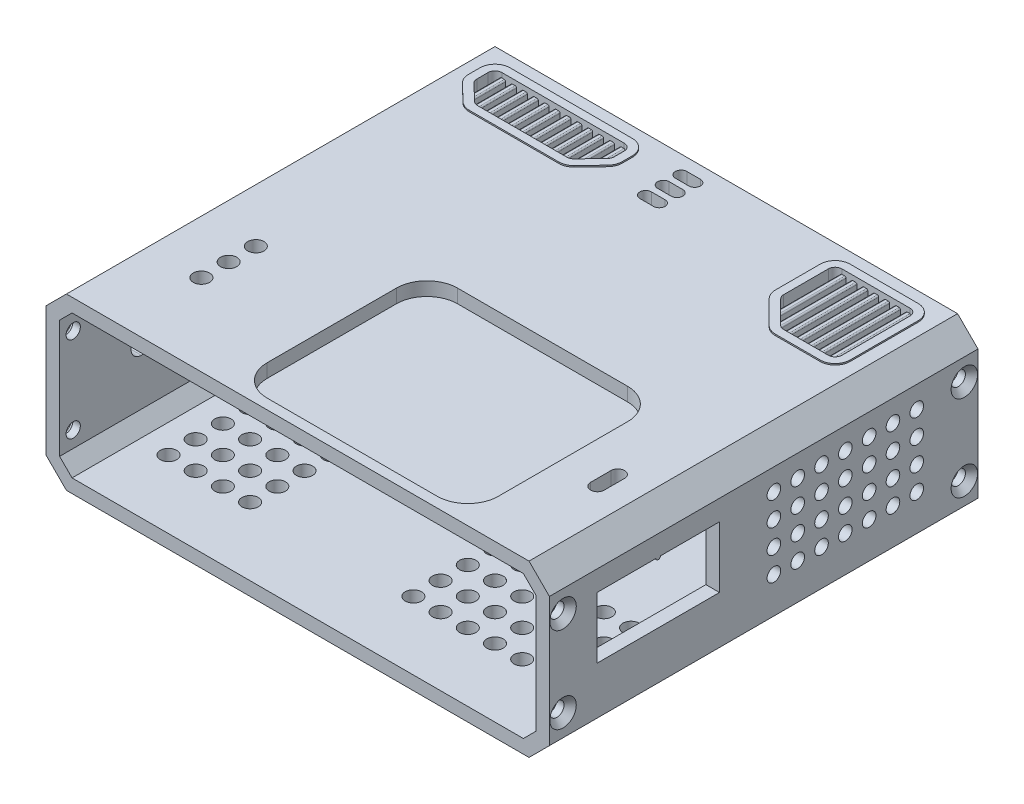
from build123d import *

# Parameters (mm, degrees)
SKETCH_1_W           = 74
SKETCH_1_H           = 63
EXTRUDE_1_DEPTH      = 25
CHAMFER_1_SIZE       = 3
CUT_EXTRUDE_1_DEPTH  = 78.238017391
CUT_EXTRUDE_2_REACH  = 67.167
CUT_EXTRUDE_3_REACH  = 67.167
SKETCH_5_R           = 1.2
SKETCH_6_R           = 1.05
CUT_EXTRUDE_4_DEPTH  = 92.384239478
CHAMFER_2_SIZE       = 0.9
CUT_EXTRUDE_5_REACH  = 67.167
CUT_EXTRUDE_6_REACH  = 93.384
CUT_EXTRUDE_7_REACH  = 93.384
SKETCH_9_W           = 4
SKETCH_9_H           = 2
FILLET_1_R           = 1
SKETCH_10_R          = 1
CUT_EXTRUDE_8_DEPTH  = 2
CUT_EXTRUDE_9_REACH  = 93.384
SKETCH_11_W          = 18
SKETCH_11_H          = 9
SKETCH_12_W          = 2
SKETCH_12_H          = 7.3
EXTRUDE_2_DEPTH      = 20
CHAMFER_3_SIZE       = 6
SKETCH_13_W          = 66.34314575
SKETCH_13_H          = 7.3
CUT_EXTRUDE_10_DEPTH = 10
SKETCH_15_R          = 1
CUT_EXTRUDE_12_DEPTH = 2
SKETCH_16_W          = 2
SKETCH_16_H          = 3
EXTRUDE_3_DEPTH      = 4
SKETCH_18_R          = 1.2
CUT_EXTRUDE_13_DEPTH = 65.426629242
SKETCH_19_R          = 0.325
EXTRUDE_4_DEPTH      = 2
EXTRUDE_5_DEPTH      = 0.2
CUT_EXTRUDE_START    = -2
CUT_EXTRUDE_15_DEPTH = 2
SKETCH_23_W          = 0.8
SKETCH_23_H          = 13.273646536
SKETCH_23_H_2        = 8.723645734
EXTRUDE_6_DEPTH      = 1.5
FILLET_2_R           = 0.2
CUT_EXTRUDE_16_REACH = 67.167


with BuildPart() as part:
    # 草图1 → 凸台-拉伸1 (new body)
    with BuildSketch(Plane(origin=(0, 0, 0), x_dir=(1, 0, 0), z_dir=(0, 1, 0))):
        with Locations((0.036621478, 15.935)):
            Rectangle(SKETCH_1_W, SKETCH_1_H)
    extrude(amount=EXTRUDE_1_DEPTH)

    # 倒角1
    chamfer_1_edges = [part.edges().sort_by_distance(p)[0] for p in [
        (37.036621478, 25, -15.935),
        (-36.963378522, 25, -15.935),
        (37.036621478, 0, -15.935),
        (-36.963378522, 0, -15.935),
    ]]
    chamfer(chamfer_1_edges, length=CHAMFER_1_SIZE)

    # 草图2 → 切除-拉伸1 (cut, through all)
    with BuildSketch(Plane.XY.offset(15.565)):
        Polygon((-33.134951397, 2), (33.208194353, 2), (35.036621478, 3.828427125), (35.036621478, 21.171572875), (33.208194353, 23), (-33.134951397, 23), (-34.963378522, 21.171572875), (-34.963378522, 3.828427125), align=None)
    extrude(amount=-CUT_EXTRUDE_1_DEPTH, mode=Mode.SUBTRACT)

    # 草图4 → 切除-拉伸2 (cut, up to next)
    with BuildSketch(Plane(origin=(0, 25, 0), x_dir=(1, 0, 0), z_dir=(0, 1, 0)), mode=Mode.PRIVATE) as cut_extrude_2_sk1:
        with BuildLine():
            Line((-5.963378522, 13.935), (19.036621478, 13.935))
            ThreePointArc((19.036621478, 13.935), (22.218601993, 12.616980515), (23.536621478, 9.435))
            Line((23.536621478, 9.435), (23.536621478, -9.565))
            ThreePointArc((23.536621478, -9.565), (22.218601993, -12.746980515), (19.036621478, -14.065))
            Line((19.036621478, -14.065), (-5.963378522, -14.065))
            ThreePointArc((-5.963378522, -14.065), (-9.145359037, -12.746980515), (-10.463378522, -9.565))
            Line((-10.463378522, -9.565), (-10.463378522, 9.435))
            ThreePointArc((-10.463378522, 9.435), (-9.145359037, 12.616980515), (-5.963378522, 13.935))
        make_face()
    cut_extrude_2_tool1 = extrude(cut_extrude_2_sk1.sketch, amount=-CUT_EXTRUDE_2_REACH, mode=Mode.PRIVATE) & part.part
    add(cut_extrude_2_tool1.solids().sort_by_distance((6.536621, 25, 0.065))[0], mode=Mode.SUBTRACT)

    # 草图5 → 切除-拉伸3 (cut, up to next)
    with BuildSketch(Plane(origin=(0, 25, 0), x_dir=(1, 0, 0), z_dir=(0, 1, 0)), mode=Mode.PRIVATE) as cut_extrude_3_sk1:
        with Locations(Location((-26.117438699, 0.435, 0), (0, 0, 270))):
            Circle(SKETCH_5_R)
    cut_extrude_3_tool1 = extrude(cut_extrude_3_sk1.sketch, amount=-CUT_EXTRUDE_3_REACH, mode=Mode.PRIVATE) & part.part
    # 草图5 → 切除-拉伸3 (cut, up to next)
    with BuildSketch(Plane(origin=(0, 25, 0), x_dir=(1, 0, 0), z_dir=(0, 1, 0)), mode=Mode.PRIVATE) as cut_extrude_3_sk2:
        with Locations(Location((-26.117438699, 4.435, 0), (0, 0, 270))):
            Circle(SKETCH_5_R)
    cut_extrude_3_tool2 = extrude(cut_extrude_3_sk2.sketch, amount=-CUT_EXTRUDE_3_REACH, mode=Mode.PRIVATE) & part.part
    # 草图5 → 切除-拉伸3 (cut, up to next)
    with BuildSketch(Plane(origin=(0, 25, 0), x_dir=(1, 0, 0), z_dir=(0, 1, 0)), mode=Mode.PRIVATE) as cut_extrude_3_sk3:
        with Locations(Location((-26.117438699, -3.565, 0), (0, 0, 270))):
            Circle(SKETCH_5_R)
    cut_extrude_3_tool3 = extrude(cut_extrude_3_sk3.sketch, amount=-CUT_EXTRUDE_3_REACH, mode=Mode.PRIVATE) & part.part
    add(cut_extrude_3_tool1.solids().sort_by_distance((-26.117439, 25, -0.435))[0], mode=Mode.SUBTRACT)
    add(cut_extrude_3_tool2.solids().sort_by_distance((-26.117439, 25, -4.435))[0], mode=Mode.SUBTRACT)
    add(cut_extrude_3_tool3.solids().sort_by_distance((-26.117439, 25, 3.565))[0], mode=Mode.SUBTRACT)

    # 草图6 → 切除-拉伸4 (cut, through all)
    with BuildSketch(Plane(origin=(37.036621478, 0, 0), x_dir=(0, 0, -1), z_dir=(1, 0, 0))):
        with Locations((-13.565, 18.8)):
            Circle(SKETCH_6_R)
        with Locations((-13.565, 6.2)):
            Circle(SKETCH_6_R)
        with Locations((45.435, 6.2)):
            Circle(SKETCH_6_R)
        with Locations((45.435, 18.8)):
            Circle(SKETCH_6_R)
    extrude(amount=-CUT_EXTRUDE_4_DEPTH, mode=Mode.SUBTRACT)

    # 倒角2
    chamfer_2_edges = [part.edges().sort_by_distance(p)[0] for p in [
        (-36.963378522, 18.8, -44.385),
        (37.036621478, 18.8, -44.385),
        (-36.963378522, 6.2, -44.385),
        (37.036621478, 6.2, -44.385),
        (-36.963378522, 6.2, 14.615),
        (37.036621478, 6.2, 14.615),
        (-36.963378522, 18.8, 14.615),
        (37.036621478, 18.8, 14.615),
    ]]
    chamfer(chamfer_2_edges, length=CHAMFER_2_SIZE)

    # 草图7 → 切除-拉伸5 (cut, up to next)
    with BuildSketch(Plane(origin=(0, 25, 0), x_dir=(1, 0, 0), z_dir=(0, 1, 0)), mode=Mode.PRIVATE) as cut_extrude_5_sk1:
        with BuildLine():
            Line((30.536621478, 1.9890604), (30.536621478, -1.0109396))
            ThreePointArc((30.536621478, -1.0109396), (29.536621478, -2.0109396), (28.536621478, -1.0109396))
            Line((28.536621478, -1.0109396), (28.536621478, 1.9890604))
            ThreePointArc((28.536621478, 1.9890604), (29.536621478, 2.9890604), (30.536621478, 1.9890604))
        make_face()
    cut_extrude_5_tool1 = extrude(cut_extrude_5_sk1.sketch, amount=-CUT_EXTRUDE_5_REACH, mode=Mode.PRIVATE) & part.part
    add(cut_extrude_5_tool1.solids().sort_by_distance((29.536621, 25, -0.48906))[0], mode=Mode.SUBTRACT)

    # 草图8 → 切除-拉伸6 (cut, up to next)
    with BuildSketch(Plane.ZY.offset(36.963378522), mode=Mode.PRIVATE) as cut_extrude_6_sk1:
        with BuildLine():
            Line((-8.435, 13.7), (3.565, 13.7))
            ThreePointArc((3.565, 13.7), (5.065, 12.2), (3.565, 10.7))
            Line((3.565, 10.7), (-8.435, 10.7))
            ThreePointArc((-8.435, 10.7), (-9.935, 12.2), (-8.435, 13.7))
        make_face()
    cut_extrude_6_tool1 = extrude(cut_extrude_6_sk1.sketch, amount=-CUT_EXTRUDE_6_REACH, mode=Mode.PRIVATE) & part.part
    add(cut_extrude_6_tool1.solids().sort_by_distance((-36.963379, 12.2, -2.435))[0], mode=Mode.SUBTRACT)

    # 草图9 → 切除-拉伸7 (cut, up to next)
    with BuildSketch(Plane.ZY.offset(36.963378522), mode=Mode.PRIVATE) as cut_extrude_7_sk1:
        with Locations((-5.435, 6)):
            Rectangle(SKETCH_9_W, SKETCH_9_H)
    cut_extrude_7_tool1 = extrude(cut_extrude_7_sk1.sketch, amount=-CUT_EXTRUDE_7_REACH, mode=Mode.PRIVATE) & part.part
    add(cut_extrude_7_tool1.solids().sort_by_distance((-36.963379, 6, -5.435))[0], mode=Mode.SUBTRACT)

    # 圆角1
    fillet_1_edges = [part.edges().sort_by_distance(p)[0] for p in [
        (-35.963378522, 5, -3.435),
        (-35.963378522, 7, -3.435),
        (-35.963378522, 7, -7.435),
        (-35.963378522, 5, -7.435),
    ]]
    fillet(fillet_1_edges, radius=FILLET_1_R - 0.0001)  # a hair under: the kernel refuses the full size

    # 草图10 → 切除-拉伸8 (cut)
    with BuildSketch(Plane.ZY.offset(36.963378522)):
        with Locations((6.465, 19)):
            Circle(SKETCH_10_R)
        with Locations((3.265, 19)):
            Circle(SKETCH_10_R)
        with Locations((0.065, 19)):
            Circle(SKETCH_10_R)
        with Locations((-3.135, 19)):
            Circle(SKETCH_10_R)
        with Locations((-6.335, 19)):
            Circle(SKETCH_10_R)
        with Locations((3.265, 15.8)):
            Circle(SKETCH_10_R)
        with Locations((0.065, 15.8)):
            Circle(SKETCH_10_R)
        with Locations((-3.135, 15.8)):
            Circle(SKETCH_10_R)
        with Locations((-6.335, 15.8)):
            Circle(SKETCH_10_R)
        with Locations((6.465, 15.8)):
            Circle(SKETCH_10_R)
        with Locations((-9.535, 19)):
            Circle(SKETCH_10_R)
        with Locations((-12.735, 19)):
            Circle(SKETCH_10_R)
        with Locations((-15.935, 19)):
            Circle(SKETCH_10_R)
        with Locations((-19.135, 19)):
            Circle(SKETCH_10_R)
        with Locations((-22.335, 19)):
            Circle(SKETCH_10_R)
        with Locations((-25.535, 19)):
            Circle(SKETCH_10_R)
        with Locations((-28.735, 19)):
            Circle(SKETCH_10_R)
        with Locations((-31.935, 19)):
            Circle(SKETCH_10_R)
        with Locations((-35.135, 19)):
            Circle(SKETCH_10_R)
        with Locations((-38.335, 19)):
            Circle(SKETCH_10_R)
        with Locations((-9.535, 15.8)):
            Circle(SKETCH_10_R)
        with Locations((-12.735, 15.8)):
            Circle(SKETCH_10_R)
        with Locations((-15.935, 15.8)):
            Circle(SKETCH_10_R)
        with Locations((-19.135, 15.8)):
            Circle(SKETCH_10_R)
        with Locations((-22.335, 15.8)):
            Circle(SKETCH_10_R)
        with Locations((-25.535, 15.8)):
            Circle(SKETCH_10_R)
        with Locations((-28.735, 15.8)):
            Circle(SKETCH_10_R)
        with Locations((-31.935, 15.8)):
            Circle(SKETCH_10_R)
        with Locations((-35.135, 15.8)):
            Circle(SKETCH_10_R)
        with Locations((-38.335, 15.8)):
            Circle(SKETCH_10_R)
    extrude(amount=-CUT_EXTRUDE_8_DEPTH, mode=Mode.SUBTRACT)

    # 草图11 → 切除-拉伸9 (cut, up to next)
    with BuildSketch(Plane(origin=(37.036621478, 0, 0), x_dir=(0, 0, -1), z_dir=(1, 0, 0)), mode=Mode.PRIVATE) as cut_extrude_9_sk1:
        with Locations((0.435, 14.5)):
            Rectangle(SKETCH_11_W, SKETCH_11_H)
    cut_extrude_9_tool1 = extrude(cut_extrude_9_sk1.sketch, amount=-CUT_EXTRUDE_9_REACH, mode=Mode.PRIVATE) & part.part
    add(cut_extrude_9_tool1.solids().sort_by_distance((37.036621, 14.5, -0.435))[0], mode=Mode.SUBTRACT)

    # 草图12 → 凸台-拉伸2 (add)
    with BuildSketch(Plane(origin=(0, 0, -47.435), x_dir=(-1, 0, 0), z_dir=(0, 0, -1))):
        with Locations((25.963378522, 19.35)):
            Rectangle(SKETCH_12_W, SKETCH_12_H)
        with Locations((-16.036621478, 19.35)):
            Rectangle(SKETCH_12_W, SKETCH_12_H)
    extrude(amount=-EXTRUDE_2_DEPTH)

    # 倒角3
    chamfer_3_edges = [part.edges().sort_by_distance(p)[0] for p in [
        (-25.963378522, 15.7, -27.435),
        (16.036621478, 15.7, -27.435),
    ]]
    chamfer(chamfer_3_edges, length=CHAMFER_3_SIZE)

    # 草图13 → 切除-拉伸10 (cut)
    with BuildSketch(Plane(origin=(0, 0, -47.435), x_dir=(-1, 0, 0), z_dir=(0, 0, -1))):
        with Locations((-0.036621478, 19.35)):
            Rectangle(SKETCH_13_W, SKETCH_13_H)
    extrude(amount=-CUT_EXTRUDE_10_DEPTH, mode=Mode.SUBTRACT)

    # 草图15 → 切除-拉伸12 (cut)
    with BuildSketch(Plane(origin=(37.036621478, 0, 0), x_dir=(0, 0, -1), z_dir=(1, 0, 0))):
        with Locations((38.435, 18.8)):
            Circle(SKETCH_15_R)
        with Locations((34.935, 18.8)):
            Circle(SKETCH_15_R)
        with Locations((31.435, 18.8)):
            Circle(SKETCH_15_R)
        with Locations((27.935, 18.8)):
            Circle(SKETCH_15_R)
        with Locations((24.435, 18.8)):
            Circle(SKETCH_15_R)
        with Locations((20.935, 18.8)):
            Circle(SKETCH_15_R)
        with Locations((17.435, 18.8)):
            Circle(SKETCH_15_R)
        with Locations((34.935, 15.3)):
            Circle(SKETCH_15_R)
        with Locations((31.435, 15.3)):
            Circle(SKETCH_15_R)
        with Locations((27.935, 15.3)):
            Circle(SKETCH_15_R)
        with Locations((24.435, 15.3)):
            Circle(SKETCH_15_R)
        with Locations((20.935, 15.3)):
            Circle(SKETCH_15_R)
        with Locations((17.435, 15.3)):
            Circle(SKETCH_15_R)
        with Locations((34.935, 11.8)):
            Circle(SKETCH_15_R)
        with Locations((31.435, 11.8)):
            Circle(SKETCH_15_R)
        with Locations((27.935, 11.8)):
            Circle(SKETCH_15_R)
        with Locations((24.435, 11.8)):
            Circle(SKETCH_15_R)
        with Locations((20.935, 11.8)):
            Circle(SKETCH_15_R)
        with Locations((17.435, 11.8)):
            Circle(SKETCH_15_R)
        with Locations((34.935, 8.3)):
            Circle(SKETCH_15_R)
        with Locations((31.435, 8.3)):
            Circle(SKETCH_15_R)
        with Locations((27.935, 8.3)):
            Circle(SKETCH_15_R)
        with Locations((24.435, 8.3)):
            Circle(SKETCH_15_R)
        with Locations((20.935, 8.3)):
            Circle(SKETCH_15_R)
        with Locations((17.435, 8.3)):
            Circle(SKETCH_15_R)
        with Locations((38.435, 15.3)):
            Circle(SKETCH_15_R)
        with Locations((38.435, 11.8)):
            Circle(SKETCH_15_R)
        with Locations((38.435, 8.3)):
            Circle(SKETCH_15_R)
    extrude(amount=-CUT_EXTRUDE_12_DEPTH, mode=Mode.SUBTRACT)

    # 草图16 → 凸台-拉伸3 (add)
    with BuildSketch(Plane.XZ.offset(-23)):
        with Locations((-27.599018842, -17.035)):
            Rectangle(SKETCH_16_W, SKETCH_16_H)
        with Locations((27.668194353, -17.035)):
            Rectangle(SKETCH_16_W, SKETCH_16_H)
    extrude(amount=EXTRUDE_3_DEPTH)

    # 草图18 → 切除-拉伸13 (cut, through all)
    with BuildSketch(Plane(origin=(0, 2, 0), x_dir=(1, 0, 0), z_dir=(0, 1, 0))):
        with Locations(Location((27.036621478, 6.435, 0), (0, 0, 270))):
            Circle(SKETCH_18_R)
        with Locations(Location((23.036621478, 6.435, 0), (0, 0, 270))):
            Circle(SKETCH_18_R)
        with Locations(Location((19.036621478, 6.435, 0), (0, 0, 270))):
            Circle(SKETCH_18_R)
        with Locations(Location((15.036621478, 6.435, 0), (0, 0, 270))):
            Circle(SKETCH_18_R)
        with Locations(Location((11.036621478, 6.435, 0), (0, 0, 270))):
            Circle(SKETCH_18_R)
        with Locations(Location((7.036621478, 6.435, 0), (0, 0, 270))):
            Circle(SKETCH_18_R)
        with Locations(Location((23.036621478, 2.435, 0), (0, 0, 270))):
            Circle(SKETCH_18_R)
        with Locations(Location((19.036621478, 2.435, 0), (0, 0, 270))):
            Circle(SKETCH_18_R)
        with Locations(Location((15.036621478, 2.435, 0), (0, 0, 270))):
            Circle(SKETCH_18_R)
        with Locations(Location((11.036621478, 2.435, 0), (0, 0, 270))):
            Circle(SKETCH_18_R)
        with Locations(Location((7.036621478, 2.435, 0), (0, 0, 270))):
            Circle(SKETCH_18_R)
        with Locations(Location((23.036621478, -1.565, 0), (0, 0, 270))):
            Circle(SKETCH_18_R)
        with Locations(Location((19.036621478, -1.565, 0), (0, 0, 270))):
            Circle(SKETCH_18_R)
        with Locations(Location((15.036621478, -1.565, 0), (0, 0, 270))):
            Circle(SKETCH_18_R)
        with Locations(Location((11.036621478, -1.565, 0), (0, 0, 270))):
            Circle(SKETCH_18_R)
        with Locations(Location((7.036621478, -1.565, 0), (0, 0, 270))):
            Circle(SKETCH_18_R)
        with Locations(Location((23.036621478, -5.565, 0), (0, 0, 270))):
            Circle(SKETCH_18_R)
        with Locations(Location((19.036621478, -5.565, 0), (0, 0, 270))):
            Circle(SKETCH_18_R)
        with Locations(Location((15.036621478, -5.565, 0), (0, 0, 270))):
            Circle(SKETCH_18_R)
        with Locations(Location((11.036621478, -5.565, 0), (0, 0, 270))):
            Circle(SKETCH_18_R)
        with Locations(Location((7.036621478, -5.565, 0), (0, 0, 270))):
            Circle(SKETCH_18_R)
        with Locations(Location((27.036621478, 2.435, 0), (0, 0, 270))):
            Circle(SKETCH_18_R)
        with Locations(Location((27.036621478, -1.565, 0), (0, 0, 270))):
            Circle(SKETCH_18_R)
        with Locations(Location((27.036621478, -5.565, 0), (0, 0, 270))):
            Circle(SKETCH_18_R)
        with Locations(Location((-16.963378522, 6.435, 0), (0, 0, 270))):
            Circle(SKETCH_18_R)
        with Locations(Location((-20.963378522, 6.435, 0), (0, 0, 270))):
            Circle(SKETCH_18_R)
        with Locations(Location((-24.963378522, 6.435, 0), (0, 0, 270))):
            Circle(SKETCH_18_R)
        with Locations(Location((-20.963378522, 2.435, 0), (0, 0, 270))):
            Circle(SKETCH_18_R)
        with Locations(Location((-24.963378522, 2.435, 0), (0, 0, 270))):
            Circle(SKETCH_18_R)
        with Locations(Location((-20.963378522, -1.565, 0), (0, 0, 270))):
            Circle(SKETCH_18_R)
        with Locations(Location((-24.963378522, -1.565, 0), (0, 0, 270))):
            Circle(SKETCH_18_R)
        with Locations(Location((-20.963378522, -5.565, 0), (0, 0, 270))):
            Circle(SKETCH_18_R)
        with Locations(Location((-24.963378522, -5.565, 0), (0, 0, 270))):
            Circle(SKETCH_18_R)
        with Locations(Location((-16.963378522, 2.435, 0), (0, 0, 270))):
            Circle(SKETCH_18_R)
        with Locations(Location((-16.963378522, -1.565, 0), (0, 0, 270))):
            Circle(SKETCH_18_R)
        with Locations(Location((-16.963378522, -5.565, 0), (0, 0, 270))):
            Circle(SKETCH_18_R)
        with Locations(Location((-28.963378522, 6.435, 0), (0, 0, 270))):
            Circle(SKETCH_18_R)
        with Locations(Location((-28.963378522, 2.435, 0), (0, 0, 270))):
            Circle(SKETCH_18_R)
        with Locations(Location((-28.963378522, -1.565, 0), (0, 0, 270))):
            Circle(SKETCH_18_R)
        with Locations(Location((-28.963378522, -5.565, 0), (0, 0, 270))):
            Circle(SKETCH_18_R)
    extrude(amount=-CUT_EXTRUDE_13_DEPTH, mode=Mode.SUBTRACT)

    # 草图19 → 凸台-拉伸4 (add)
    with BuildSketch(Plane(origin=(37.036621478, 0, 0), x_dir=(0, 0, -1), z_dir=(1, 0, 0))):
        with Locations((0.435, 19)):
            Circle(SKETCH_19_R)
    extrude(amount=-EXTRUDE_4_DEPTH)

    # 草图21 → 凸台-拉伸5 (add)
    # profile 1 of 2: a face of its own
    with BuildSketch(Plane(origin=(0, 25, 0), x_dir=(1, 0, 0), z_dir=(0, 1, 0))):
        with BuildLine():
            Line((-11.963378522, 45.635), (-29.963378522, 45.635))
            ThreePointArc((-29.963378522, 45.635), (-31.519013441, 44.990634919), (-32.163378522, 43.435))
            Line((-32.163378522, 43.435), (-32.163378522, 41.755780742))
            ThreePointArc((-32.163378522, 41.755780742), (-31.9875052, 40.893857782), (-31.488004713, 40.169743234))
            Line((-31.488004713, 40.169743234), (-29.073743874, 37.848962491))
            ThreePointArc((-29.073743874, 37.848962491), (-28.370919813, 37.394254729), (-27.549117683, 37.235))
            Line((-27.549117683, 37.235), (-14.377639361, 37.235))
            ThreePointArc((-14.377639361, 37.235), (-13.5157164, 37.410873322), (-12.791601853, 37.910373809))
            Line((-12.791601853, 37.910373809), (-10.377341014, 40.421880085))
            ThreePointArc((-10.377341014, 40.421880085), (-9.922633251, 41.124704146), (-9.763378522, 41.946506276))
            Line((-9.763378522, 41.946506276), (-9.763378522, 43.435))
            ThreePointArc((-9.763378522, 43.435), (-10.407743603, 44.990634919), (-11.963378522, 45.635))
        make_face()
        with BuildLine():
            Line((-11.963378522, 44.435), (-29.963378522, 44.435))
            ThreePointArc((-29.963378522, 44.435), (-30.670485303, 44.142106781), (-30.963378522, 43.435))
            Line((-30.963378522, 43.435), (-30.963378522, 41.755780742))
            ThreePointArc((-30.963378522, 41.755780742), (-30.883436103, 41.363997578), (-30.656390427, 41.034854602))
            Line((-30.656390427, 41.034854602), (-28.242129588, 38.71407386))
            ThreePointArc((-28.242129588, 38.71407386), (-27.922664106, 38.507388513), (-27.549117683, 38.435))
            Line((-27.549117683, 38.435), (-14.377639361, 38.435))
            ThreePointArc((-14.377639361, 38.435), (-13.985856197, 38.514942419), (-13.656713221, 38.741988095))
            Line((-13.656713221, 38.741988095), (-11.242452382, 41.253494371))
            ThreePointArc((-11.242452382, 41.253494371), (-11.035767035, 41.572959853), (-10.963378522, 41.946506276))
            Line((-10.963378522, 41.946506276), (-10.963378522, 43.435))
            ThreePointArc((-10.963378522, 43.435), (-11.256271741, 44.142106781), (-11.963378522, 44.435))
        make_face(mode=Mode.SUBTRACT)
    # profile 2 of 2: a face of its own
    with BuildSketch(Plane(origin=(0, 25, 0), x_dir=(1, 0, 0), z_dir=(0, 1, 0))):
        with BuildLine():
            Line((32.236621478, 43.435), (32.236621478, 33.435))
            ThreePointArc((32.236621478, 33.435), (31.592256397, 31.879365081), (30.036621478, 31.235))
            Line((30.036621478, 31.235), (23.45083504, 31.235))
            ThreePointArc((23.45083504, 31.235), (22.608931489, 31.402465028), (21.895200122, 31.879365081))
            Line((21.895200122, 31.879365081), (18.480986559, 35.293578644))
            ThreePointArc((18.480986559, 35.293578644), (18.004086506, 36.007310011), (17.836621478, 36.849213562))
            Line((17.836621478, 36.849213562), (17.836621478, 43.435))
            ThreePointArc((17.836621478, 43.435), (18.480986559, 44.990634919), (20.036621478, 45.635))
            Line((20.036621478, 45.635), (30.036621478, 45.635))
            ThreePointArc((30.036621478, 45.635), (31.592256397, 44.990634919), (32.236621478, 43.435))
        make_face()
        with BuildLine():
            Line((31.036621478, 43.435), (31.036621478, 33.435))
            ThreePointArc((31.036621478, 33.435), (30.743728259, 32.727893219), (30.036621478, 32.435))
            Line((30.036621478, 32.435), (23.45083504, 32.435))
            ThreePointArc((23.45083504, 32.435), (23.068151608, 32.511120467), (22.743728259, 32.727893219))
            Line((22.743728259, 32.727893219), (19.329514697, 36.142106781))
            ThreePointArc((19.329514697, 36.142106781), (19.112741945, 36.46653013), (19.036621478, 36.849213562))
            Line((19.036621478, 36.849213562), (19.036621478, 43.435))
            ThreePointArc((19.036621478, 43.435), (19.329514697, 44.142106781), (20.036621478, 44.435))
            Line((20.036621478, 44.435), (30.036621478, 44.435))
            ThreePointArc((30.036621478, 44.435), (30.743728259, 44.142106781), (31.036621478, 43.435))
        make_face(mode=Mode.SUBTRACT)
    extrude(amount=EXTRUDE_5_DEPTH)

    # 草图22 → 切除-拉伸15 (cut)
    with BuildSketch(Plane(origin=(0, 25, 0), x_dir=(1, 0, 0), z_dir=(0, 1, 0)).offset(CUT_EXTRUDE_START)):
        with BuildLine():
            Line((-13.656713221, 38.741988095), (-11.242452382, 41.253494371))
            ThreePointArc((-11.242452382, 41.253494371), (-11.035767035, 41.572959853), (-10.963378522, 41.946506276))
            Line((-10.963378522, 41.946506276), (-10.963378522, 43.435))
            ThreePointArc((-10.963378522, 43.435), (-11.256271741, 44.142106781), (-11.963378522, 44.435))
            Line((-11.963378522, 44.435), (-29.963378522, 44.435))
            ThreePointArc((-29.963378522, 44.435), (-30.670485303, 44.142106781), (-30.963378522, 43.435))
            Line((-30.963378522, 43.435), (-30.963378522, 41.755780742))
            ThreePointArc((-30.963378522, 41.755780742), (-30.883436103, 41.363997578), (-30.656390427, 41.034854602))
            Line((-30.656390427, 41.034854602), (-28.242129588, 38.71407386))
            ThreePointArc((-28.242129588, 38.71407386), (-27.922664106, 38.507388513), (-27.549117683, 38.435))
            Line((-27.549117683, 38.435), (-14.377639361, 38.435))
            ThreePointArc((-14.377639361, 38.435), (-13.985856197, 38.514942419), (-13.656713221, 38.741988095))
        make_face()
        with BuildLine():
            Line((30.036621478, 44.435), (20.036621478, 44.435))
            ThreePointArc((20.036621478, 44.435), (19.329514697, 44.142106781), (19.036621478, 43.435))
            Line((19.036621478, 43.435), (19.036621478, 36.849213562))
            ThreePointArc((19.036621478, 36.849213562), (19.112741945, 36.46653013), (19.329514697, 36.142106781))
            Line((19.329514697, 36.142106781), (22.743728259, 32.727893219))
            ThreePointArc((22.743728259, 32.727893219), (23.068151608, 32.511120467), (23.45083504, 32.435))
            Line((23.45083504, 32.435), (30.036621478, 32.435))
            ThreePointArc((30.036621478, 32.435), (30.743728259, 32.727893219), (31.036621478, 33.435))
            Line((31.036621478, 33.435), (31.036621478, 43.435))
            ThreePointArc((31.036621478, 43.435), (30.743728259, 44.142106781), (30.036621478, 44.435))
        make_face()
    extrude(amount=CUT_EXTRUDE_15_DEPTH, mode=Mode.SUBTRACT)

    # 草图23 → 凸台-拉伸6 (add)
    with BuildSketch(Plane(origin=(0, 24.5, 0), x_dir=(1, 0, 0), z_dir=(0, 1, 0))):
        with Locations((28.236621478, 39.089661721)):
            Rectangle(SKETCH_23_W, SKETCH_23_H)
        with Locations((29.836621478, 39.089661721)):
            Rectangle(SKETCH_23_W, SKETCH_23_H)
        with Locations((26.636621478, 39.089661721)):
            Rectangle(SKETCH_23_W, SKETCH_23_H)
        with Locations((25.036621478, 39.089661721)):
            Rectangle(SKETCH_23_W, SKETCH_23_H)
        with Locations((23.436621478, 39.089661721)):
            Rectangle(SKETCH_23_W, SKETCH_23_H)
        with Locations((21.836621478, 39.089661721)):
            Rectangle(SKETCH_23_W, SKETCH_23_H)
        with Locations((20.236621478, 39.089661721)):
            Rectangle(SKETCH_23_W, SKETCH_23_H)
        with Locations((-13.799353953, 42.090509087)):
            Rectangle(SKETCH_23_W, SKETCH_23_H_2)
        with Locations((-12.199353953, 42.090509087)):
            Rectangle(SKETCH_23_W, SKETCH_23_H_2)
        with Locations((-15.399353953, 42.090509087)):
            Rectangle(SKETCH_23_W, SKETCH_23_H_2)
        with Locations((-16.999353953, 42.090509087)):
            Rectangle(SKETCH_23_W, SKETCH_23_H_2)
        with Locations((-18.599353953, 42.090509087)):
            Rectangle(SKETCH_23_W, SKETCH_23_H_2)
        with Locations((-20.199353953, 42.090509087)):
            Rectangle(SKETCH_23_W, SKETCH_23_H_2)
        with Locations((-21.799353953, 42.090509087)):
            Rectangle(SKETCH_23_W, SKETCH_23_H_2)
        with Locations((-23.399353953, 42.090509087)):
            Rectangle(SKETCH_23_W, SKETCH_23_H_2)
        with Locations((-24.999353953, 42.090509087)):
            Rectangle(SKETCH_23_W, SKETCH_23_H_2)
        with Locations((-26.599353953, 42.090509087)):
            Rectangle(SKETCH_23_W, SKETCH_23_H_2)
        with Locations((-28.199353953, 42.090509087)):
            Rectangle(SKETCH_23_W, SKETCH_23_H_2)
        with Locations((-29.799353953, 42.090509087)):
            Rectangle(SKETCH_23_W, SKETCH_23_H_2)
    extrude(amount=-EXTRUDE_6_DEPTH)

    # 圆角2
    fillet_2_edges = [part.edges().sort_by_distance(p)[0] for p in [
        (-28.599353953, 24.5, -41.746233255),
        (-27.799353953, 24.5, -41.450907599),
        (-26.999353953, 24.5, -41.435),
        (-26.199353953, 24.5, -41.435),
        (-25.399353953, 24.5, -41.435),
        (-24.599353953, 24.5, -41.435),
        (-23.799353953, 24.5, -41.435),
        (-22.999353953, 24.5, -41.435),
        (-22.199353953, 24.5, -41.435),
        (-21.399353953, 24.5, -41.435),
        (-20.599353953, 24.5, -41.435),
        (-19.799353953, 24.5, -41.435),
        (-18.999353953, 24.5, -41.435),
        (-18.199353953, 24.5, -41.435),
        (-17.399353953, 24.5, -41.435),
        (-16.599353953, 24.5, -41.435),
        (-15.799353953, 24.5, -41.435),
        (-14.999353953, 24.5, -41.435),
        (-14.199353953, 24.5, -41.443010591),
        (-13.399353953, 24.5, -41.722356844),
        (-12.599353953, 24.5, -42.13846868),
        (-11.799353953, 24.5, -42.547808643),
        (-30.199353953, 24.5, -42.501136793),
        (19.836621478, 24.5, -40.024897949),
        (20.636621478, 24.5, -39.635),
        (21.436621478, 24.5, -39.235),
        (22.236621478, 24.5, -38.835),
        (23.036621478, 24.5, -38.479910139),
        (23.836621478, 24.5, -38.443919227),
        (24.636621478, 24.5, -38.443919227),
        (25.436621478, 24.5, -38.443919227),
        (26.236621478, 24.5, -38.443919227),
        (27.036621478, 24.5, -38.443919227),
        (27.836621478, 24.5, -38.443919227),
        (28.636621478, 24.5, -38.443919227),
        (29.436621478, 24.5, -38.443919227),
        (30.236621478, 24.5, -38.435),
        (-29.399353953, 24.5, -42.130745269),
    ]]
    fillet(fillet_2_edges, radius=FILLET_2_R)

    # 草图24 → 切除-拉伸16 (cut, up to next)
    with BuildSketch(Plane(origin=(0, 25, 0), x_dir=(1, 0, 0), z_dir=(0, 1, 0)), mode=Mode.PRIVATE) as cut_extrude_16_sk1:
        with BuildLine():
            Line((-3.963378522, 45.635), (-1.963378522, 45.635))
            ThreePointArc((-1.963378522, 45.635), (-1.113378522, 44.785), (-1.963378522, 43.935))
            Line((-1.963378522, 43.935), (-3.963378522, 43.935))
            ThreePointArc((-3.963378522, 43.935), (-4.813378522, 44.785), (-3.963378522, 45.635))
        make_face()
    cut_extrude_16_tool1 = extrude(cut_extrude_16_sk1.sketch, amount=-CUT_EXTRUDE_16_REACH, mode=Mode.PRIVATE) & part.part
    # 草图24 → 切除-拉伸16 (cut, up to next)
    with BuildSketch(Plane(origin=(0, 25, 0), x_dir=(1, 0, 0), z_dir=(0, 1, 0)), mode=Mode.PRIVATE) as cut_extrude_16_sk2:
        with BuildLine():
            Line((-3.963378522, 43.035), (-1.963378522, 43.035))
            ThreePointArc((-1.963378522, 43.035), (-1.113378522, 42.185), (-1.963378522, 41.335))
            Line((-1.963378522, 41.335), (-3.963378522, 41.335))
            ThreePointArc((-3.963378522, 41.335), (-4.813378522, 42.185), (-3.963378522, 43.035))
        make_face()
    cut_extrude_16_tool2 = extrude(cut_extrude_16_sk2.sketch, amount=-CUT_EXTRUDE_16_REACH, mode=Mode.PRIVATE) & part.part
    # 草图24 → 切除-拉伸16 (cut, up to next)
    with BuildSketch(Plane(origin=(0, 25, 0), x_dir=(1, 0, 0), z_dir=(0, 1, 0)), mode=Mode.PRIVATE) as cut_extrude_16_sk3:
        with BuildLine():
            Line((-3.963378522, 40.435), (-1.963378522, 40.435))
            ThreePointArc((-1.963378522, 40.435), (-1.113378522, 39.585), (-1.963378522, 38.735))
            Line((-1.963378522, 38.735), (-3.963378522, 38.735))
            ThreePointArc((-3.963378522, 38.735), (-4.813378522, 39.585), (-3.963378522, 40.435))
        make_face()
    cut_extrude_16_tool3 = extrude(cut_extrude_16_sk3.sketch, amount=-CUT_EXTRUDE_16_REACH, mode=Mode.PRIVATE) & part.part
    add(cut_extrude_16_tool1.solids().sort_by_distance((-2.963379, 25, -44.785))[0], mode=Mode.SUBTRACT)
    add(cut_extrude_16_tool2.solids().sort_by_distance((-2.963379, 25, -42.185))[0], mode=Mode.SUBTRACT)
    add(cut_extrude_16_tool3.solids().sort_by_distance((-2.963379, 25, -39.585))[0], mode=Mode.SUBTRACT)


solid = part.part
